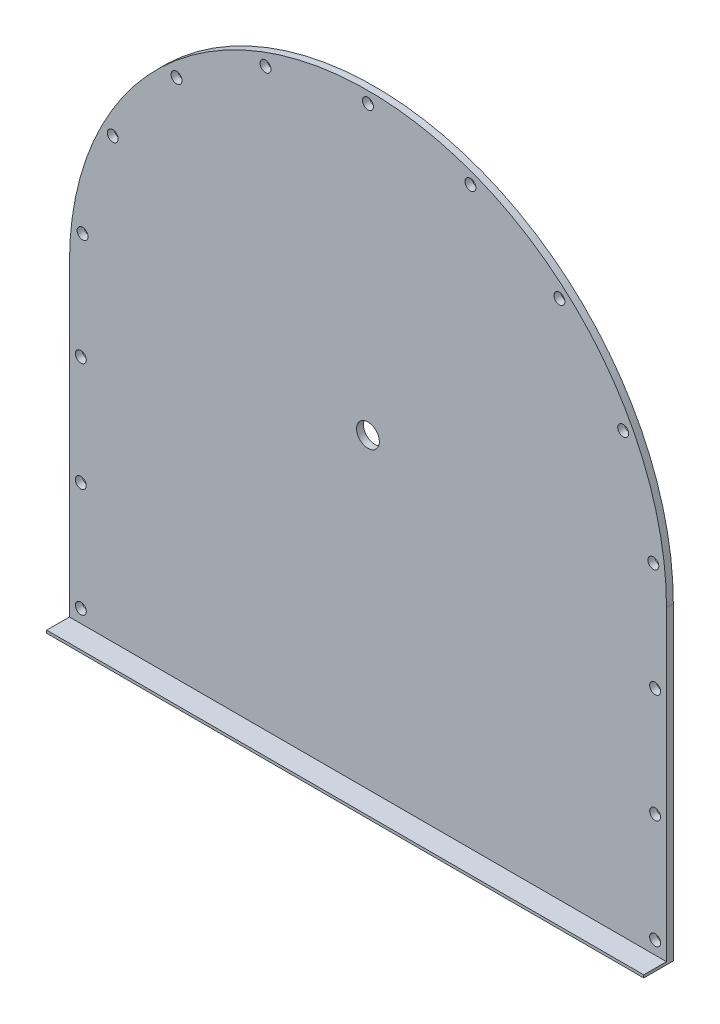
from build123d import *

# Parameters (mm, degrees)
BOSS_EXTRUDE1_DEPTH     = 15
SKETCH2_R               = 12
CUT_EXTRUDE1_DEPTH      = 1489.441130848
CRVPATTERN1_OUTLINE_R   = 12
CRVPATTERN1_DEPTH       = 15
CUT_EXTRUDE2_DEPTH      = 1489.441130848
CUT_EXTRUDE2_DEPTH_BACK = 1489.441130848
SKETCH4_R               = 25
SKETCH5_W               = 1312
SKETCH5_H               = 6
BOSS_EXTRUDE2_DEPTH     = 50


# Read off the part's stored shape, not the designer's step: CrvPattern1
with BuildPart() as part:
    # Sketch1 → Boss-Extrude1 (new body)
    with BuildSketch(Plane.XY):
        with BuildLine():
            Line((-656, 0), (656, 0))
            Line((656, 0), (656, 680))
            ThreePointArc((656, 680), (0, 1336), (-656, 680))
            Line((-656, 680), (-656, 0))
        make_face()
    extrude(amount=BOSS_EXTRUDE1_DEPTH)

    # Sketch2 → Cut-Extrude1 (cut, symmetric)
    with BuildSketch(Plane.XY.offset(15)):
        with Locations((631, 35)):
            Circle(SKETCH2_R)
    cut_extrude1 = extrude(amount=CUT_EXTRUDE1_DEPTH, both=True, mode=Mode.SUBTRACT)

    # CrvPattern1 outline → CrvPattern1 (cut)
    with BuildSketch(Plane.XY):
        with Locations((0, 1311)):
            Circle(CRVPATTERN1_OUTLINE_R)
        with Locations((225.15315866, 1269.463362004)):
            Circle(CRVPATTERN1_OUTLINE_R)
        with Locations((420.664145387, 1150.321886356)):
            Circle(CRVPATTERN1_OUTLINE_R)
        with Locations((560.793280055, 969.260949742)):
            Circle(CRVPATTERN1_OUTLINE_R)
        with Locations((627.092089955, 750.117834504)):
            Circle(CRVPATTERN1_OUTLINE_R)
        with Locations((631, 513.697825822)):
            Circle(CRVPATTERN1_OUTLINE_R)
        with Locations((631, 274.348912911)):
            Circle(CRVPATTERN1_OUTLINE_R)
    crvpattern1 = extrude(amount=CRVPATTERN1_DEPTH, mode=Mode.SUBTRACT)

    # Mirror1: Cut-Extrude1, CrvPattern1 across plane
    add(cut_extrude1.mirror(Plane(origin=(0, 0, 0), x_dir=(0, 0, 1), z_dir=(1, 0, 0))), mode=Mode.SUBTRACT)
    add(crvpattern1.mirror(Plane(origin=(0, 0, 0), x_dir=(0, 0, 1), z_dir=(1, 0, 0))), mode=Mode.SUBTRACT)

    # Sketch4 → Cut-Extrude2 (cut, two sides: drawn at the far end of the back side and taken through both)
    with BuildSketch(Plane.XY.offset(15).offset(-CUT_EXTRUDE2_DEPTH_BACK)):
        with Locations((0, 680)):
            Circle(SKETCH4_R)
    extrude(amount=CUT_EXTRUDE2_DEPTH + CUT_EXTRUDE2_DEPTH_BACK, mode=Mode.SUBTRACT)

    # Sketch5 → Boss-Extrude2 (add)
    with BuildSketch(Plane.XY.offset(15)):
        with Locations((0, 3)):
            Rectangle(SKETCH5_W, SKETCH5_H)
    extrude(amount=BOSS_EXTRUDE2_DEPTH)


solid = part.part
